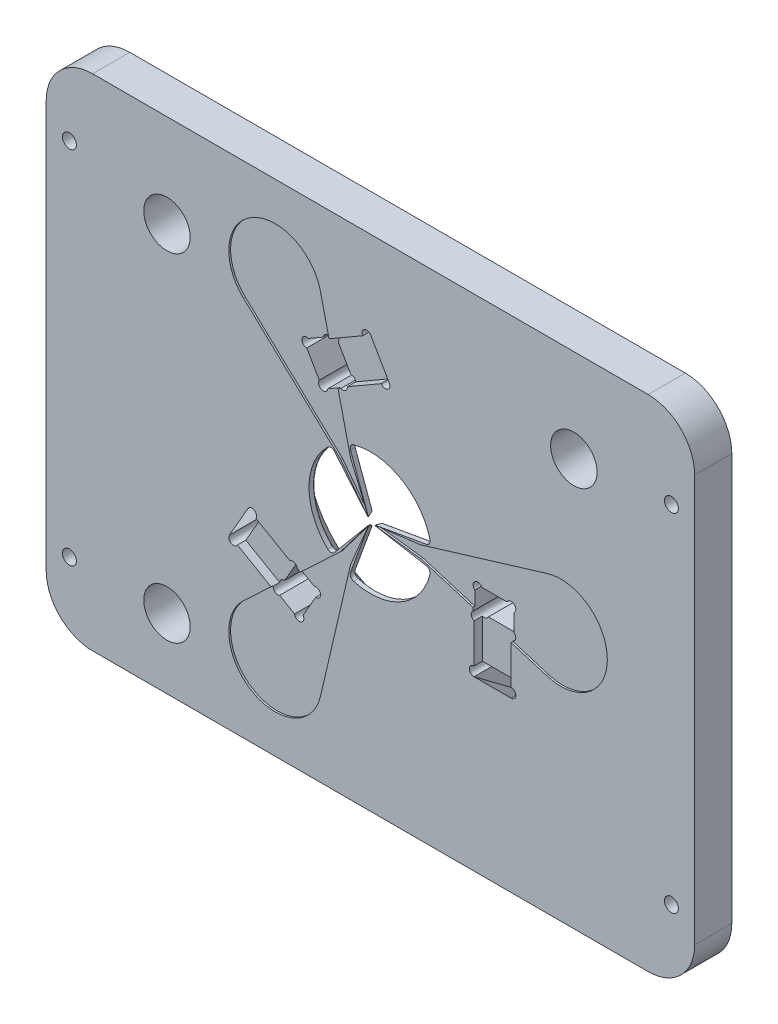
from build123d import *
from build123d.topology import SkipClean

# Parameters (mm, degrees)
SKETCH_1_W           = 76
SKETCH_1_H           = 60
EXTRUDE_1_DEPTH      = 4
CUT_EXTRUDE_1_DEPTH  = 0.5
SKETCH_5_W           = 76
SKETCH_5_H           = 60
CUT_EXTRUDE_4_DEPTH  = 10
CUT_EXTRUDE_5_DEPTH  = 45.244999717
SKETCH_9_R           = 0.75
CUT_EXTRUDE_6_DEPTH  = 45.244999717
CUT_EXTRUDE_8_DEPTH  = 0.5
EXTRUDE_START        = 0.5
EXTRUDE_2_DEPTH      = 0.5
SKETCH_17_R          = 2.5
CUT_EXTRUDE_9_DEPTH  = 45.244999727
SKETCH_18_W          = 4
SKETCH_18_H          = 4.45
CUT_EXTRUDE_10_DEPTH = 0.9
CUT_EXTRUDE_11_DEPTH = 0.2
CUT_EXTRUDE_12_DEPTH = 4
CUT_EXTRUDE_13_DEPTH = 4
CUT_EXTRUDE_14_DEPTH = 4


with BuildPart() as part:
    # 草圖1 → 填料-伸長1 (new body)
    with BuildSketch(Plane.XY):
        Rectangle(SKETCH_1_W, SKETCH_1_H)
    extrude(amount=EXTRUDE_1_DEPTH)

    # 草圖2 → 除料-伸長1 (cut)
    with BuildSketch(Plane.XY.offset(4)):
        with BuildLine():
            Line((0.357380647, 0.004961492), (4.50941379, 0.523267787))
            ThreePointArc((4.50941379, 0.523267787), (5.349803134, 0.664770922), (6.175092484, 0.877314741))
            Line((6.175092484, 0.877314741), (19.047808057, 4.784468472))
            ThreePointArc((19.047808057, 4.784468472), (25.5, 0), (19.047808057, -4.784468472))
            Line((19.047808057, -4.784468472), (6.175092484, -0.877314741))
            ThreePointArc((6.175092484, -0.877314741), (5.349803134, -0.664770922), (4.50941379, -0.523267787))
            Line((4.50941379, -0.523267787), (0.357380647, -0.004961492))
            ThreePointArc((0.357380647, -0.004961492), (0.353, 0), (0.357380647, 0.004961492))
        make_face()
        with BuildLine():
            Line((-2.327769389, -5.786444332), (-5.380432788, -18.8881199))
            ThreePointArc((-5.380432788, -18.8881199), (-12.75, -22.083647797), (-13.667375269, -14.103651428))
            Line((-13.667375269, -14.103651428), (-3.847323094, -4.909129591))
            ThreePointArc((-3.847323094, -4.909129591), (-3.250610073, -4.300679958), (-2.707870091, -3.643633005))
            Line((-2.707870091, -3.643633005), (-0.182987102, -0.307019973))
            ThreePointArc((-0.182987102, -0.307019973), (-0.1765, -0.305706968), (-0.174393546, -0.311981465))
            Line((-0.174393546, -0.311981465), (-1.801543699, -4.166900792))
            ThreePointArc((-1.801543699, -4.166900792), (-2.09919306, -4.96545088), (-2.327769389, -5.786444332))
        make_face()
        with BuildLine():
            Line((-3.847323094, 4.909129591), (-13.667375269, 14.103651428))
            ThreePointArc((-13.667375269, 14.103651428), (-12.75, 22.083647797), (-5.380432788, 18.8881199))
            Line((-5.380432788, 18.8881199), (-2.327769389, 5.786444332))
            ThreePointArc((-2.327769389, 5.786444332), (-2.09919306, 4.96545088), (-1.801543699, 4.166900792))
            Line((-1.801543699, 4.166900792), (-0.174393546, 0.311981465))
            ThreePointArc((-0.174393546, 0.311981465), (-0.1765, 0.305706968), (-0.182987102, 0.307019973))
            Line((-0.182987102, 0.307019973), (-2.707870091, 3.643633005))
            ThreePointArc((-2.707870091, 3.643633005), (-3.250610073, 4.300679958), (-3.847323094, 4.909129591))
        make_face()
    extrude(amount=-CUT_EXTRUDE_1_DEPTH, mode=Mode.SUBTRACT)

    # 草圖5 → 除料-伸長4 (cut)
    with BuildSketch(Plane.XY.offset(4)):
        Rectangle(SKETCH_5_W, SKETCH_5_H)
        with BuildLine():
            ThreePointArc((-34.9, 21.9), (-33.435533906, 25.435533906), (-29.9, 26.9))
            Line((-29.9, 26.9), (29.9, 26.9))
            ThreePointArc((29.9, 26.9), (33.435533906, 25.435533906), (34.9, 21.9))
            Line((34.9, 21.9), (34.9, -21.9))
            ThreePointArc((34.9, -21.9), (33.435533906, -25.435533906), (29.9, -26.9))
            Line((29.9, -26.9), (-29.9, -26.9))
            ThreePointArc((-29.9, -26.9), (-33.435533906, -25.435533906), (-34.9, -21.9))
            Line((-34.9, -21.9), (-34.9, 21.9))
        make_face(mode=Mode.SUBTRACT)
    extrude(amount=-CUT_EXTRUDE_4_DEPTH, mode=Mode.SUBTRACT)

    # 草圖7 → 除料-伸長5 (cut, through all)
    with BuildSketch(Plane.XY.offset(4)):
        with BuildLine():
            ThreePointArc((11.798296094, -0.228571429), (11.03056096, -0.065346), (11.05, -0.85))
            Line((11.05, -0.85), (11.05, -2.707142857))
            ThreePointArc((11.05, -2.707142857), (11.03056096, -3.491796857), (11.798296094, -3.328571429))
            Line((11.798296094, -3.328571429), (14.501703906, -3.328571429))
            ThreePointArc((14.501703906, -3.328571429), (15.26943904, -3.491796857), (15.25, -2.707142857))
            Line((15.25, -2.707142857), (15.25, -0.85))
            ThreePointArc((15.25, -0.85), (15.26943904, -0.065346), (14.501703906, -0.228571429))
            Line((14.501703906, -0.228571429), (11.798296094, -0.228571429))
        make_face()
        with BuildLine():
            Line((-6.261121593, -9.144580712), (-7.869454486, -8.216009283))
            ThreePointArc((-7.869454486, -8.216009283), (-8.539265263, -7.806847581), (-8.781775462, -8.553338424))
            Line((-8.781775462, -8.553338424), (-10.133479369, -10.894558267))
            ThreePointArc((-10.133479369, -10.894558267), (-10.658704303, -11.477823681), (-9.969454486, -11.853315979))
            Line((-9.969454486, -11.853315979), (-8.361121593, -12.781887408))
            ThreePointArc((-8.361121593, -12.781887408), (-7.691310816, -13.19104911), (-7.448800617, -12.444558267))
            Line((-7.448800617, -12.444558267), (-6.097096711, -10.103338424))
            ThreePointArc((-6.097096711, -10.103338424), (-5.571871776, -9.520073009), (-6.261121593, -9.144580712))
        make_face()
        with BuildLine():
            ThreePointArc((-6.888878407, 13.631887408), (-7.578128224, 13.25639511), (-7.052903289, 12.673129695))
            Line((-7.052903289, 12.673129695), (-5.701199383, 10.331909853))
            ThreePointArc((-5.701199383, 10.331909853), (-5.458689184, 9.585419009), (-4.788878407, 9.994580712))
            Line((-4.788878407, 9.994580712), (-3.180545514, 10.92315214))
            ThreePointArc((-3.180545514, 10.92315214), (-2.491295697, 11.298644438), (-3.016520631, 11.881909853))
            Line((-3.016520631, 11.881909853), (-4.368224538, 14.223129695))
            ThreePointArc((-4.368224538, 14.223129695), (-4.610734737, 14.969620539), (-5.280545514, 14.560458836))
            Line((-5.280545514, 14.560458836), (-6.888878407, 13.631887408))
        make_face()
        with BuildLine():
            Line((15.15, -7.778571429), (11.15, -7.778571429))
            ThreePointArc((11.15, -7.778571429), (10.65, -8.278571429), (11.15, -8.778571429))
            Line((11.15, -8.778571429), (15.15, -8.778571429))
            ThreePointArc((15.15, -8.778571429), (15.65, -8.278571429), (15.15, -7.778571429))
        make_face()
        with BuildLine():
            Line((-14.311440462, -9.230999153), (-12.311440462, -5.766897538))
            ThreePointArc((-12.311440462, -5.766897538), (-12.494453164, -5.083884836), (-13.177465866, -5.266897538))
            Line((-13.177465866, -5.266897538), (-15.177465866, -8.730999153))
            ThreePointArc((-15.177465866, -8.730999153), (-14.994453164, -9.414011855), (-14.311440462, -9.230999153))
        make_face()
        with BuildLine():
            Line((2.027465866, 14.045468966), (0.027465866, 17.509570582))
            ThreePointArc((0.027465866, 17.509570582), (-0.655546836, 17.692583284), (-0.838559538, 17.009570582))
            Line((-0.838559538, 17.009570582), (1.161440462, 13.545468966))
            ThreePointArc((1.161440462, 13.545468966), (1.844453164, 13.362456265), (2.027465866, 14.045468966))
        make_face()
    extrude(amount=-CUT_EXTRUDE_5_DEPTH, mode=Mode.SUBTRACT)

    # 草圖9 → 除料-伸長6 (cut, through all)
    with BuildSketch(Plane.XY.offset(4)):
        with Locations((32.4, 17.9)):
            Circle(SKETCH_9_R)
        with Locations((-32.4, 19.4)):
            Circle(SKETCH_9_R)
        with Locations((-32.4, -19.4)):
            Circle(SKETCH_9_R)
        with Locations((32.4, -19.4)):
            Circle(SKETCH_9_R)
    extrude(amount=-CUT_EXTRUDE_6_DEPTH, mode=Mode.SUBTRACT)

    # 草圖13 → 除料-伸長8 (cut)
    with BuildSketch(Plane.XY.offset(4)):
        with BuildLine():
            Line((0.357380647, 0.004961492), (6.014835927, 0.998098116))
            ThreePointArc((6.014835927, 0.998098116), (6.347886554, 1.218503693), (6.413293243, 1.61248758))
            ThreePointArc((6.413293243, 1.61248758), (3.30645, 5.726939393), (-1.810191414, 6.36031866))
            ThreePointArc((-1.810191414, 6.36031866), (-2.118688124, 6.106682863), (-2.143039639, 5.708049771))
            Line((-2.143039639, 5.708049771), (-0.174393546, 0.311981465))
            ThreePointArc((-0.174393546, 0.311981465), (-0.1765, 0.305706968), (-0.182987102, 0.307019973))
            Line((-0.182987102, 0.307019973), (-3.871796288, 4.709951655))
            ThreePointArc((-3.871796288, 4.709951655), (-4.22919843, 4.88817917), (-4.603101829, 4.74783108))
            ThreePointArc((-4.603101829, 4.74783108), (-6.6129, 0), (-4.603101829, -4.74783108))
            ThreePointArc((-4.603101829, -4.74783108), (-4.22919843, -4.88817917), (-3.871796288, -4.709951655))
            Line((-3.871796288, -4.709951655), (-0.182987102, -0.307019973))
            ThreePointArc((-0.182987102, -0.307019973), (-0.1765, -0.305706968), (-0.174393546, -0.311981465))
            Line((-0.174393546, -0.311981465), (-2.143039639, -5.708049771))
            ThreePointArc((-2.143039639, -5.708049771), (-2.118688124, -6.106682863), (-1.810191414, -6.36031866))
            ThreePointArc((-1.810191414, -6.36031866), (3.30645, -5.726939393), (6.413293243, -1.61248758))
            ThreePointArc((6.413293243, -1.61248758), (6.347886554, -1.218503693), (6.014835927, -0.998098116))
            Line((6.014835927, -0.998098116), (0.357380647, -0.004961492))
            ThreePointArc((0.357380647, -0.004961492), (0.353, 0), (0.357380647, 0.004961492))
        make_face()
    extrude(amount=-CUT_EXTRUDE_8_DEPTH, mode=Mode.SUBTRACT)

    # 草圖12 → 填料-伸長2 (add)
    with SkipClean():  # the faces are left unmerged after this step: merging them gives an invalid solid
        with BuildSketch(Plane.XY.offset(3.5).offset(EXTRUDE_START)):
            with BuildLine():
                Line((11.05, -2.356956933), (11.05, -0.85))
                ThreePointArc((11.05, -0.85), (11.03056096, -0.065346), (11.798296094, -0.228571429))
                Line((11.798296094, -0.228571429), (14.501703906, -0.228571429))
                ThreePointArc((14.501703906, -0.228571429), (15.26943904, -0.065346), (15.25, -0.85))
                Line((15.25, -0.85), (15.25, -2.707142857))
                ThreePointArc((15.25, -2.707142857), (15.442536346, -3.193212295), (15.09656548, -3.585179007))
                Line((15.09656548, -3.585179007), (19.047808057, -4.784468472))
                ThreePointArc((19.047808057, -4.784468472), (25.5, 0), (19.047808057, 4.784468472))
                Line((19.047808057, 4.784468472), (6.175092484, 0.877314741))
                ThreePointArc((6.175092484, 0.877314741), (5.349803134, 0.664770922), (4.50941379, 0.523267787))
                Line((4.50941379, 0.523267787), (0.357380647, 0.004961492))
                ThreePointArc((0.357380647, 0.004961492), (0.353, 0), (0.357380647, -0.004961492))
                Line((0.357380647, -0.004961492), (4.50941379, -0.523267787))
                ThreePointArc((4.50941379, -0.523267787), (5.349803134, -0.664770922), (6.175092484, -0.877314741))
                Line((6.175092484, -0.877314741), (11.05, -2.356956933))
            make_face()
            with BuildLine():
                Line((-10.653138837, -11.281419712), (-13.667375269, -14.103651428))
                ThreePointArc((-13.667375269, -14.103651428), (-12.75, -22.083647797), (-5.380432788, -18.8881199))
                Line((-5.380432788, -18.8881199), (-2.327769389, -5.786444332))
                ThreePointArc((-2.327769389, -5.786444332), (-2.09919306, -4.96545088), (-1.801543699, -4.166900792))
                Line((-1.801543699, -4.166900792), (-0.174393546, -0.311981465))
                ThreePointArc((-0.174393546, -0.311981465), (-0.1765, -0.305706968), (-0.182987102, -0.307019973))
                Line((-0.182987102, -0.307019973), (-2.707870091, -3.643633005))
                ThreePointArc((-2.707870091, -3.643633005), (-3.250610073, -4.300679958), (-3.847323094, -4.909129591))
                Line((-3.847323094, -4.909129591), (-7.56618458, -8.391102245))
                Line((-7.56618458, -8.391102245), (-6.261121593, -9.144580712))
                ThreePointArc((-6.261121593, -9.144580712), (-5.571871776, -9.520073009), (-6.097096711, -10.103338424))
                Line((-6.097096711, -10.103338424), (-7.448800617, -12.444558267))
                ThreePointArc((-7.448800617, -12.444558267), (-7.691310816, -13.19104911), (-8.361121593, -12.781887408))
                Line((-8.361121593, -12.781887408), (-9.969454486, -11.853315979))
                ThreePointArc((-9.969454486, -11.853315979), (-10.48667114, -11.777022627), (-10.653138837, -11.281419712))
            make_face()
            with BuildLine():
                Line((-3.48381542, 10.748059178), (-4.788878407, 9.994580712))
                ThreePointArc((-4.788878407, 9.994580712), (-5.458689184, 9.585419009), (-5.701199383, 10.331909853))
                Line((-5.701199383, 10.331909853), (-7.052903289, 12.673129695))
                ThreePointArc((-7.052903289, 12.673129695), (-7.578128224, 13.25639511), (-6.888878407, 13.631887408))
                Line((-6.888878407, 13.631887408), (-5.280545514, 14.560458836))
                ThreePointArc((-5.280545514, 14.560458836), (-4.955865206, 14.970234922), (-4.443426643, 14.866598719))
                Line((-4.443426643, 14.866598719), (-5.380432788, 18.8881199))
                ThreePointArc((-5.380432788, 18.8881199), (-12.75, 22.083647797), (-13.667375269, 14.103651428))
                Line((-13.667375269, 14.103651428), (-3.847323094, 4.909129591))
                ThreePointArc((-3.847323094, 4.909129591), (-3.250610073, 4.300679958), (-2.707870091, 3.643633005))
                Line((-2.707870091, 3.643633005), (-0.182987102, 0.307019973))
                ThreePointArc((-0.182987102, 0.307019973), (-0.1765, 0.305706968), (-0.174393546, 0.311981465))
                Line((-0.174393546, 0.311981465), (-1.801543699, 4.166900792))
                ThreePointArc((-1.801543699, 4.166900792), (-2.09919306, 4.96545088), (-2.327769389, 5.786444332))
                Line((-2.327769389, 5.786444332), (-3.48381542, 10.748059178))
            make_face()
        extrude(amount=-EXTRUDE_2_DEPTH)

    # 草圖15 → 除料-旋轉2 (revolve, cut)
    with SkipClean():  # the faces are left unmerged after this step: merging them gives an invalid solid
        with BuildSketch(Plane(origin=(0, 0, 0), x_dir=(1, 0, 0), z_dir=(0, 1, 0))):
            Polygon((11.027465866, 0), (0.027465866, 0), (0.027465866, -3.5), (6.640365866, -3.5), align=None)
        revolve(axis=Axis((0.027465866, 0, 0), (0, 0, 1)), mode=Mode.SUBTRACT)

    # 草圖16 → 除料-旋轉3 (revolve, cut)
    with SkipClean():  # the faces are left unmerged after this step: merging them gives an invalid solid
        with BuildSketch(Plane(origin=(0, 0, 0), x_dir=(1, 0, 0), z_dir=(0, 1, 0))):
            Polygon((0.353, -4.18), (0.353, -3.5), (0.745598183, -3.5), align=None)
        revolve(axis=Axis((0, 0, 0), (0, 0, 1)), mode=Mode.SUBTRACT)

    # 草圖17 → 除料-伸長9 (cut, through all)
    with SkipClean():  # the faces are left unmerged after this step: merging them gives an invalid solid
        with BuildSketch(Plane.XY.offset(4)):
            with Locations((-21.9, 16.9)):
                Circle(SKETCH_17_R)
            with Locations((21.9, 16.9)):
                Circle(SKETCH_17_R)
            with Locations((-21.9, -19.4)):
                Circle(SKETCH_17_R)
        extrude(amount=-CUT_EXTRUDE_9_DEPTH, mode=Mode.SUBTRACT)

    # 草圖18 → 除料-伸長10 (cut)
    with SkipClean():  # the faces are left unmerged after this step: merging them gives an invalid solid
        with BuildSketch(Plane.XY.offset(4)):
            with Locations((13.15, -5.553571429)):
                Rectangle(SKETCH_18_W, SKETCH_18_H)
            Polygon((-0.838559538, 17.009570582), (1.161440462, 13.545468966), (-2.692372585, 11.320468966), (-4.692372585, 14.784570582), align=None)
            Polygon((-10.457627415, -11.455999153), (-8.457627415, -7.991897538), (-12.311440462, -5.766897538), (-14.311440462, -9.230999153), align=None)
        extrude(amount=-CUT_EXTRUDE_10_DEPTH, mode=Mode.SUBTRACT)

    # 草圖20 → 除料-伸長11 (cut)
    with SkipClean():  # the faces are left unmerged after this step: merging them gives an invalid solid
        with BuildSketch(Plane.XY.offset(4)):
            with BuildLine():
                Line((0.357380647, 0.004961492), (5.358, 0.629198438))
                Line((5.358, 0.629198438), (19.047772641, 4.784457722))
                ThreePointArc((19.047772641, 4.784457722), (25.5, 0), (19.047772641, -4.784457722))
                Line((19.047772641, -4.784457722), (5.358, -0.629198438))
                Line((5.358, -0.629198438), (0.357380647, -0.004961492))
                ThreePointArc((0.357380647, -0.004961492), (0.353, 0), (0.357380647, 0.004961492))
            make_face()
            with BuildLine():
                Line((-0.182987102, -0.307019973), (-3.223901831, -4.325564895))
                Line((-3.223901831, -4.325564895), (-13.667348251, -14.103626131))
                ThreePointArc((-13.667348251, -14.103626131), (-12.75, -22.083647797), (-5.380424389, -18.888083853))
                Line((-5.380424389, -18.888083853), (-2.134098169, -4.954763332))
                Line((-2.134098169, -4.954763332), (-0.174393546, -0.311981465))
                ThreePointArc((-0.174393546, -0.311981465), (-0.1765, -0.305706968), (-0.182987102, -0.307019973))
            make_face()
            with BuildLine():
                Line((-0.174393546, 0.311981465), (-2.134098169, 4.954763332))
                Line((-2.134098169, 4.954763332), (-5.380424389, 18.888083853))
                ThreePointArc((-5.380424389, 18.888083853), (-12.75, 22.083647797), (-13.667348251, 14.103626131))
                Line((-13.667348251, 14.103626131), (-3.223901831, 4.325564895))
                Line((-3.223901831, 4.325564895), (-0.182987102, 0.307019973))
                ThreePointArc((-0.182987102, 0.307019973), (-0.1765, 0.305706968), (-0.174393546, 0.311981465))
            make_face()
        extrude(amount=-CUT_EXTRUDE_11_DEPTH, mode=Mode.SUBTRACT)

    # 草圖21 → 除料-旋轉4 (revolve, cut)
    with SkipClean():  # the faces are left unmerged after this step: merging them gives an invalid solid
        with BuildSketch(Plane(origin=(0, 0, 0), x_dir=(1, 0, 0), z_dir=(0, 1, 0))):
            Polygon((0.1765, 0), (0.1765, -4.18), (0.3765, -4.18), (2.789824125, 0), align=None)
        revolve(axis=Axis((0, 0, 0), (0, 0, 1)), mode=Mode.SUBTRACT)

    # 草圖22 → 除料-伸長12 (cut)
    with SkipClean():  # the faces are left unmerged after this step: merging them gives an invalid solid
        with BuildSketch(Plane(origin=(11.15, 0, 0), x_dir=(0, 0, -1), z_dir=(1, 0, 0))):
            Polygon((-4, -8.778571429), (0, -8.778571429), (0, -11.778571429), align=None)
        extrude(amount=CUT_EXTRUDE_12_DEPTH, mode=Mode.SUBTRACT)

    # 草圖23 → 除料-伸長13 (cut)
    with SkipClean():  # the faces are left unmerged after this step: merging them gives an invalid solid
        with BuildSketch(Plane(origin=(-5.575, -9.656183252, 0), x_dir=(-0.8660254037844377, 0.5000000000000019, 0), z_dir=(-0.5000000000000019, -0.8660254037844377, 0))):
            Polygon((8.778571429, -4), (8.778571429, 0), (11.778571429, 0), align=None)
        extrude(amount=CUT_EXTRUDE_13_DEPTH, mode=Mode.SUBTRACT)

    # 草圖24 → 除料-伸長14 (cut)
    with SkipClean():  # the faces are left unmerged after this step: merging them gives an invalid solid
        with BuildSketch(Plane(origin=(-7.575, 13.120284867, 0), x_dir=(-0.8660254037844387, -0.4999999999999999, 0), z_dir=(0.49999999999999994, -0.8660254037844388, 0))):
            Polygon((-8.778571429, -4), (-8.778571429, 0), (-11.778571429, 0), align=None)
        extrude(amount=CUT_EXTRUDE_14_DEPTH, mode=Mode.SUBTRACT)


solid = part.part
